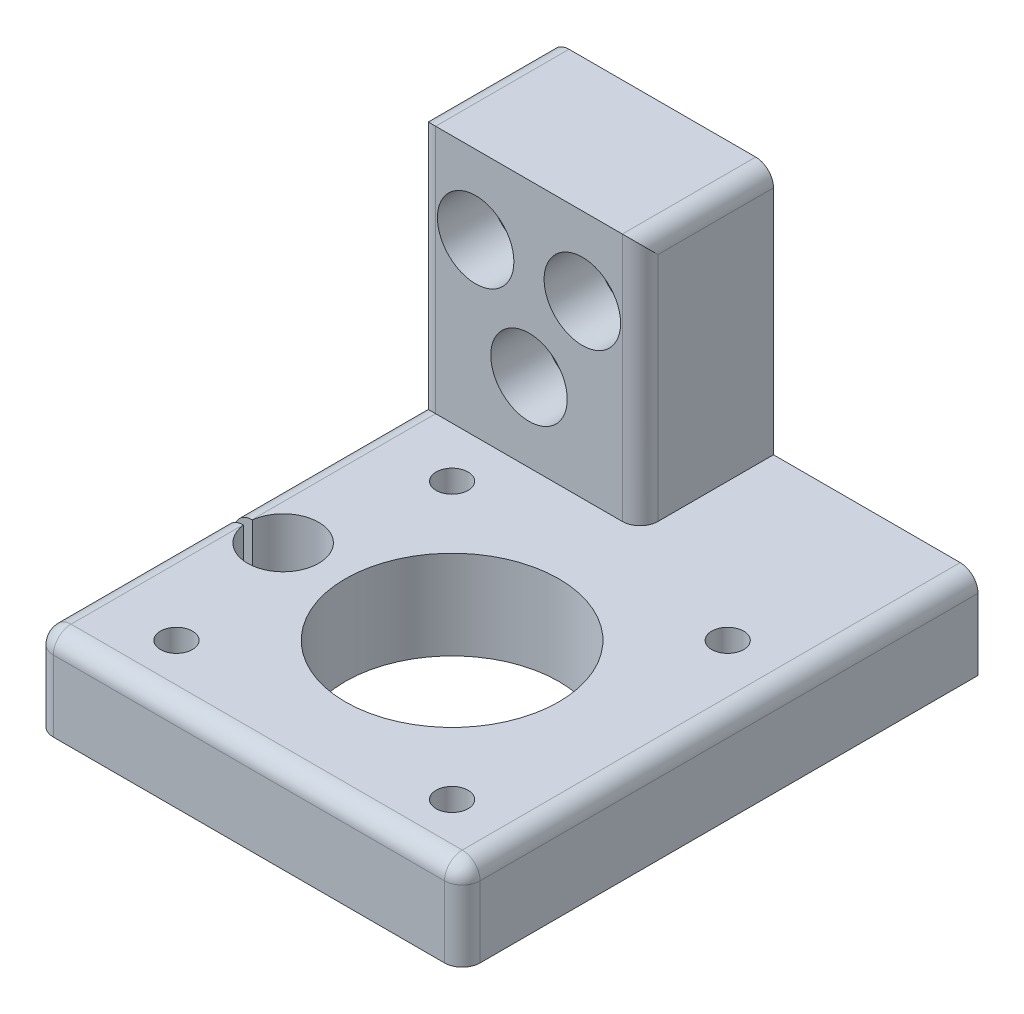
from build123d import *

# Parameters (mm, degrees)
SKETCH1_R           = 1.8
SKETCH1_R_2         = 12
BOSS_EXTRUDE1_DEPTH = 10
SKETCH2_W           = 15
SKETCH2_H           = 28
BOSS_EXTRUDE2_DEPTH = 25
SKETCH3_R           = 2.8
CUT_EXTRUDE1_DEPTH  = 75.813100457
SKETCH4_R           = 4.3
CUT_EXTRUDE2_DEPTH  = 6
FILLET1_R           = 2


with BuildPart() as part:
    # Sketch1 → Boss-Extrude1 (new body)
    with BuildSketch(Plane(origin=(0, 0, 0), x_dir=(1, 0, 0), z_dir=(0, 1, 0))):
        with BuildLine():
            Line((48, 0), (0, 0))
            Line((0, 0), (0, -35.65))
            Line((0, -35.65), (2.031373033, -35.65))
            ThreePointArc((2.031373033, -35.65), (6.25049165, -32.157850963), (10, -36.15))
            ThreePointArc((10, -36.15), (6.25049165, -40.142149037), (2.031373033, -36.65))
            Line((2.031373033, -36.65), (0, -36.65))
            Line((0, -36.65), (0, -58))
            Line((0, -58), (48, -58))
            Line((48, -58), (48, 0))
        make_face()
        with Locations((9.5, -51.65)):
            Circle(SKETCH1_R, mode=Mode.SUBTRACT)
        with Locations((40.5, -51.65)):
            Circle(SKETCH1_R, mode=Mode.SUBTRACT)
        with Locations((25, -36.15)):
            Circle(SKETCH1_R_2, mode=Mode.SUBTRACT)
        with Locations((9.5, -20.65)):
            Circle(SKETCH1_R, mode=Mode.SUBTRACT)
        with Locations((40.5, -20.65)):
            Circle(SKETCH1_R, mode=Mode.SUBTRACT)
    extrude(amount=BOSS_EXTRUDE1_DEPTH)

    # Sketch2 → Boss-Extrude2 (add)
    with BuildSketch(Plane(origin=(0, 0, 0), x_dir=(0, 0, -1), z_dir=(1, 0, 0))):
        with Locations((-7.5, 24)):
            Rectangle(SKETCH2_W, SKETCH2_H)
    extrude(amount=BOSS_EXTRUDE2_DEPTH)

    # Sketch3 → Cut-Extrude1 (cut, through all)
    with BuildSketch(Plane.XY.offset(15)):
        with Locations((6.5, 29.196152423)):
            Circle(SKETCH3_R)
        with Locations((18.5, 29.196152423)):
            Circle(SKETCH3_R)
        with Locations((12.5, 18.803847577)):
            Circle(SKETCH3_R)
    extrude(amount=-CUT_EXTRUDE1_DEPTH, mode=Mode.SUBTRACT)

    # Sketch4 → Cut-Extrude2 (cut)
    with BuildSketch(Plane.XY.offset(15)):
        with Locations((6.5, 29.196152423)):
            Circle(SKETCH4_R)
        with Locations((18.5, 29.196152423)):
            Circle(SKETCH4_R)
        with Locations((12.5, 18.803847577)):
            Circle(SKETCH4_R)
    extrude(amount=-CUT_EXTRUDE2_DEPTH, mode=Mode.SUBTRACT)

    # Fillet1
    fillet1_edges = [part.edges().sort_by_distance(p)[0] for p in [
        (48, 5, 58),
        (0, 5, 58),
        (0, 10, 47.325),
        (24, 10, 58),
        (48, 10, 29),
        (0, 24, 15),
        (0, 38, 7.5),
        (25, 24, 15),
        (25, 38, 7.5),
        (0, 10, 25.325),
    ]]
    fillet(fillet1_edges, radius=FILLET1_R)


solid = part.part
